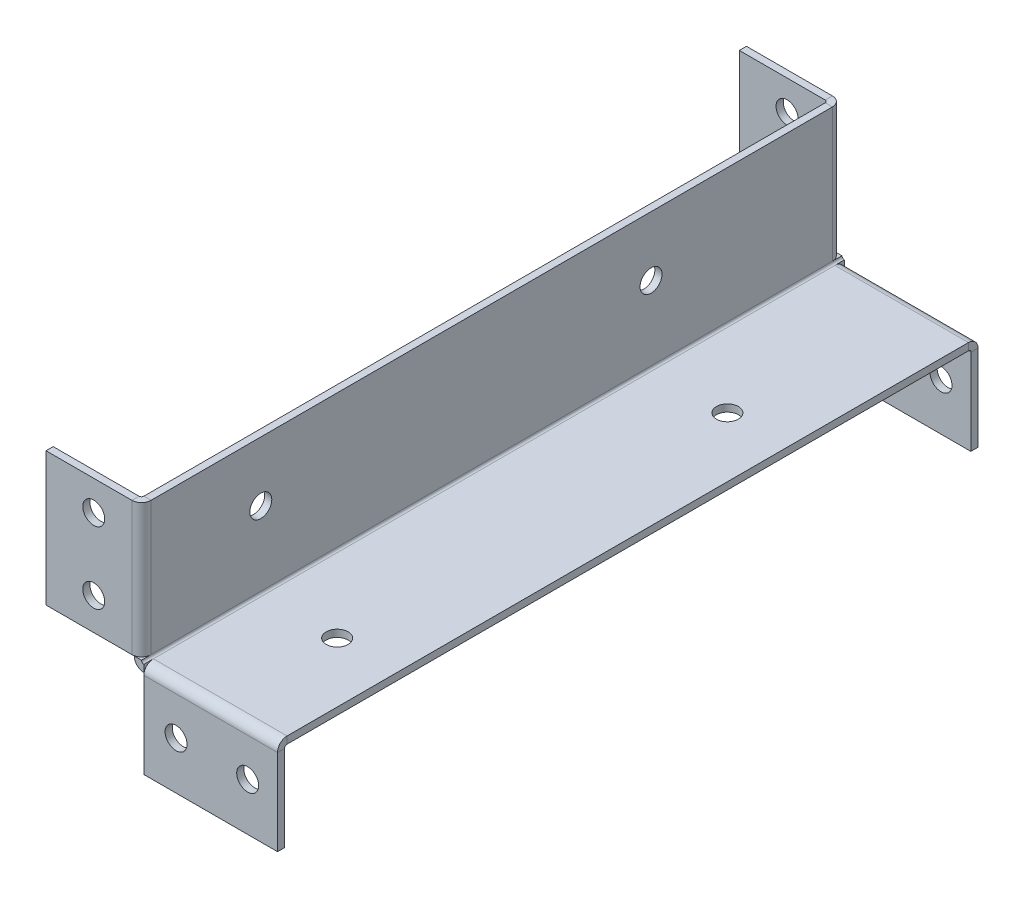
from build123d import *

# Parameters (mm, degrees)
SKETCH1_W                      = 60
SKETCH1_H                      = 293.5
BASE_FLANGE1_DEPTH             = 3
EDGE_FLANGE1_STRIP_W           = 14
EDGE_FLANGE1_STRIP_H           = 3
EDGE_FLANGE1_STRIP_CUT_DEPTH   = 293.5
EDGE_FLANGE1_DEPTH             = 293.5
EDGE_FLANGE2_STRIP_W           = 14
EDGE_FLANGE2_STRIP_H           = 3
EDGE_FLANGE2_STRIP_CUT_DEPTH   = 56
EDGE_FLANGE2_STRIP_2_W         = 14
EDGE_FLANGE2_STRIP_2_H         = 3
EDGE_FLANGE2_STRIP_CUT_2_DEPTH = 56
EDGE_FLANGE2_STRIP_3_W         = 14
EDGE_FLANGE2_STRIP_3_H         = 3
EDGE_FLANGE2_STRIP_CUT_3_DEPTH = 56
EDGE_FLANGE2_STRIP_4_W         = 14
EDGE_FLANGE2_STRIP_4_H         = 3
EDGE_FLANGE2_STRIP_CUT_4_DEPTH = 56
EDGE_FLANGE2_DEPTH             = 56
EDGE_FLANGE2_BEND_DEPTH        = 56
EDGE_FLANGE2_BEND_2_DEPTH      = 56
EDGE_FLANGE2_BEND_3_DEPTH      = 56
SKETCH18_R                     = 4.6
EXTRUDE1_DEPTH                 = 307.971089844
SKETCH19_R                     = 4.6
EXTRUDE2_DEPTH                 = 3
SKETCH20_R                     = 4.6
EXTRUDE3_DEPTH                 = 3


# Sheet-metal steps are written as plain solids
with BuildPart() as part:
    # Sketch1 → Base-Flange1 (new body)
    with BuildSketch(Plane(origin=(0, 0, 0), x_dir=(1, 0, 0), z_dir=(0, 1, 0))):
        Rectangle(SKETCH1_W, SKETCH1_H)
    extrude(amount=BASE_FLANGE1_DEPTH)

    # Edge-Flange1 strip (across the edge) → Edge-Flange1 strip cut (cut)
    with BuildSketch(Plane(origin=(-30, 3, -146.75), x_dir=(1, 0, 0), z_dir=(0, 0, 1))):
        with Locations((-3, -1.5)):
            Rectangle(EDGE_FLANGE1_STRIP_W, EDGE_FLANGE1_STRIP_H)
    extrude(amount=EDGE_FLANGE1_STRIP_CUT_DEPTH, mode=Mode.SUBTRACT)

    # Edge-Flange1 section (across the edge) → Edge-Flange1 (add)
    with BuildSketch(Plane(origin=(-30, 3, -146.75), x_dir=(1, 0, 0), z_dir=(0, 0, 1))):
        with BuildLine():
            Line((0, 1), (0, 57))
            Line((0, 57), (3, 57))
            Line((3, 57), (3, 1))
            ThreePointArc((3, 1), (3.292893219, 0.292893219), (4, 0))
            Line((4, 0), (4, -3))
            ThreePointArc((4, -3), (1.171572875, -1.828427125), (0, 1))
        make_face()
    extrude(amount=EDGE_FLANGE1_DEPTH)

    # Edge-Flange2 strip (across the edge) → Edge-Flange2 strip cut (cut)
    with BuildSketch(Plane(origin=(-30, 4, 146.75), x_dir=(0, 0, -1), z_dir=(0, 1, 0))):
        with Locations((-3, -1.5)):
            Rectangle(EDGE_FLANGE2_STRIP_W, EDGE_FLANGE2_STRIP_H)
    extrude(amount=EDGE_FLANGE2_STRIP_CUT_DEPTH, mode=Mode.SUBTRACT)

    # Edge-Flange2 strip 2 (across the edge) → Edge-Flange2 strip cut 2 (cut)
    with BuildSketch(Plane(origin=(30, 0, 146.75), x_dir=(0, 0, -1), z_dir=(-1, 0, 0))):
        with Locations((-3, -1.5)):
            Rectangle(EDGE_FLANGE2_STRIP_2_W, EDGE_FLANGE2_STRIP_2_H)
    extrude(amount=EDGE_FLANGE2_STRIP_CUT_2_DEPTH, mode=Mode.SUBTRACT)

    # Edge-Flange2 strip 3 (across the edge) → Edge-Flange2 strip cut 3 (cut)
    with BuildSketch(Plane(origin=(-30, 60, -146.75), x_dir=(0, 0, 1), z_dir=(0, -1, 0))):
        with Locations((-3, -1.5)):
            Rectangle(EDGE_FLANGE2_STRIP_3_W, EDGE_FLANGE2_STRIP_3_H)
    extrude(amount=EDGE_FLANGE2_STRIP_CUT_3_DEPTH, mode=Mode.SUBTRACT)

    # Edge-Flange2 strip 4 (across the edge) → Edge-Flange2 strip cut 4 (cut)
    with BuildSketch(Plane(origin=(-26, 0, -146.75), x_dir=(0, 0, 1), z_dir=(1, 0, 0))):
        with Locations((-3, -1.5)):
            Rectangle(EDGE_FLANGE2_STRIP_4_W, EDGE_FLANGE2_STRIP_4_H)
    extrude(amount=EDGE_FLANGE2_STRIP_CUT_4_DEPTH, mode=Mode.SUBTRACT)

    # Edge-Flange2 section (across the edge) → Edge-Flange2 (add)
    with BuildSketch(Plane(origin=(-30, 4, 146.75), x_dir=(0, 0, -1), z_dir=(0, 1, 0))):
        with BuildLine():
            Line((0, 1), (0, 37))
            Line((0, 37), (3, 37))
            Line((3, 37), (3, 1))
            ThreePointArc((3, 1), (3.292893219, 0.292893219), (4, 0))
            Line((4, 0), (4, -3))
            ThreePointArc((4, -3), (1.171572875, -1.828427125), (0, 1))
        make_face()
    extrude(amount=EDGE_FLANGE2_DEPTH)

    # Edge-Flange2 section 2 (across the edge) → Edge-Flange2 bend (add)
    with BuildSketch(Plane(origin=(30, 0, 146.75), x_dir=(0, 0, -1), z_dir=(-1, 0, 0))):
        with BuildLine():
            Line((0, 1), (0, 37))
            Line((0, 37), (3, 37))
            Line((3, 37), (3, 1))
            ThreePointArc((3, 1), (3.292893219, 0.292893219), (4, 0))
            Line((4, 0), (4, -3))
            ThreePointArc((4, -3), (1.171572875, -1.828427125), (0, 1))
        make_face()
    extrude(amount=EDGE_FLANGE2_BEND_DEPTH)

    # Edge-Flange2 section 3 (across the edge) → Edge-Flange2 bend 2 (add)
    with BuildSketch(Plane(origin=(-30, 60, -146.75), x_dir=(0, 0, 1), z_dir=(0, -1, 0))):
        with BuildLine():
            Line((0, 1), (0, 37))
            Line((0, 37), (3, 37))
            Line((3, 37), (3, 1))
            ThreePointArc((3, 1), (3.292893219, 0.292893219), (4, 0))
            Line((4, 0), (4, -3))
            ThreePointArc((4, -3), (1.171572875, -1.828427125), (0, 1))
        make_face()
    extrude(amount=EDGE_FLANGE2_BEND_2_DEPTH)

    # Edge-Flange2 section 4 (across the edge) → Edge-Flange2 bend 3 (add)
    with BuildSketch(Plane(origin=(-26, 0, -146.75), x_dir=(0, 0, 1), z_dir=(1, 0, 0))):
        with BuildLine():
            Line((0, 1), (0, 37))
            Line((0, 37), (3, 37))
            Line((3, 37), (3, 1))
            ThreePointArc((3, 1), (3.292893219, 0.292893219), (4, 0))
            Line((4, 0), (4, -3))
            ThreePointArc((4, -3), (1.171572875, -1.828427125), (0, 1))
        make_face()
    extrude(amount=EDGE_FLANGE2_BEND_3_DEPTH)

    # Sketch18 → Extrude1 (cut, through all)
    with BuildSketch(Plane.XY.offset(146.75)):
        with Locations((-47, 47.5)):
            Circle(SKETCH18_R)
        with Locations((-47, 17.5)):
            Circle(SKETCH18_R)
        with Locations((-12.5, -17)):
            Circle(SKETCH18_R)
        with Locations((17.5, -17)):
            Circle(SKETCH18_R)
    extrude(amount=-EXTRUDE1_DEPTH, mode=Mode.SUBTRACT)

    # Sketch19 → Extrude2 (cut)
    with BuildSketch(Plane(origin=(-27, 0, 0), x_dir=(0, 0, -1), z_dir=(1, 0, 0))):
        with Locations(Location((-96.75, 35, 0), (0, 0, 90))):
            Circle(SKETCH19_R)
        with Locations(Location((66.75, 35, 0), (0, 0, 90))):
            Circle(SKETCH19_R)
    extrude(amount=-EXTRUDE2_DEPTH, mode=Mode.SUBTRACT)

    # Sketch20 → Extrude3 (cut)
    with BuildSketch(Plane(origin=(0, 3, 0), x_dir=(1, 0, 0), z_dir=(0, 1, 0))):
        with Locations(Location((5, 66.75, 0), (0, 0, 270))):
            Circle(SKETCH20_R)
        with Locations(Location((5, -96.75, 0), (0, 0, 270))):
            Circle(SKETCH20_R)
    extrude(amount=-EXTRUDE3_DEPTH, mode=Mode.SUBTRACT)


solid = part.part
